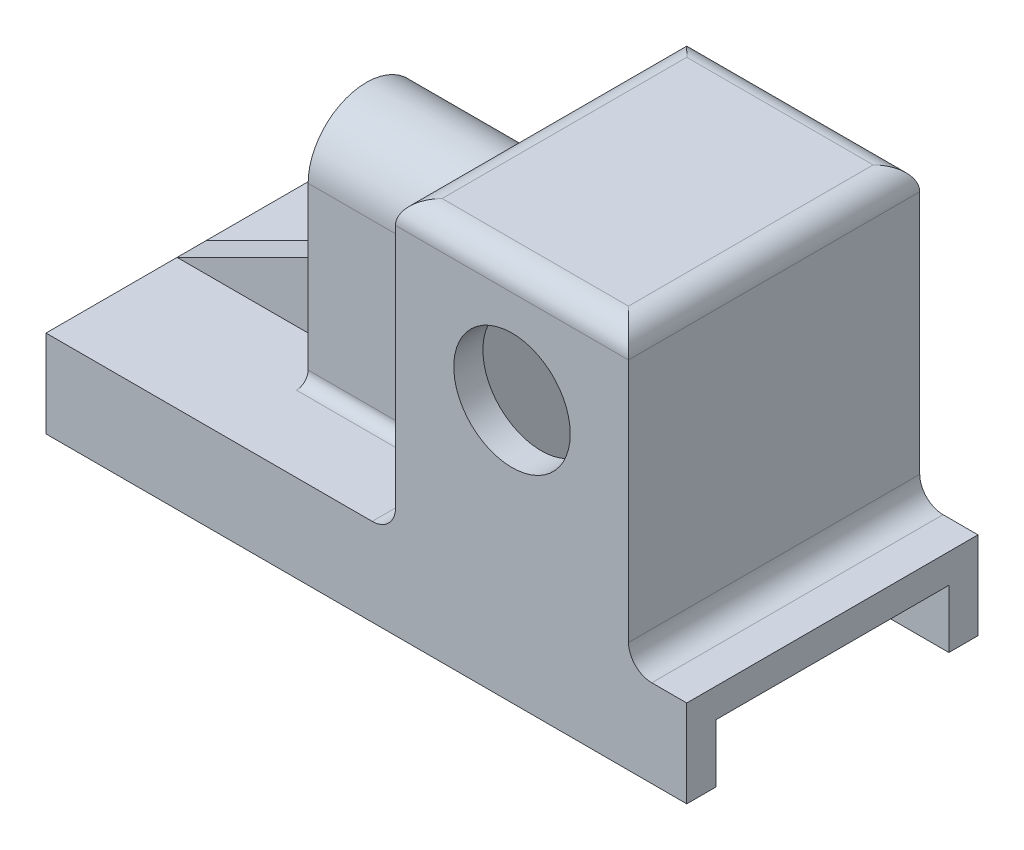
from build123d import *

# Parameters (mm, degrees)
SKETCH1_W                         = 110
SKETCH1_H                         = 15
BOSS_EXTRUDE1_DEPTH               = 25
SKETCH2_W                         = 40
SKETCH2_H                         = 10
CUT_EXTRUDE1_DEPTH                = 114.798066767
SKETCH3_W                         = 40
SKETCH3_H                         = 50
SKETCH3_R                         = 10
BOSS_EXTRUDE2_DEPTH               = 50
FILLET1_R                         = 4
CUT_EXTRUDE2_DEPTH                = 20
FILLET2_R                         = 2
BOSS_EXTRUDE3_DEPTH               = 30
RIB2_REACH                        = 90.741
SKETCH7_WALL_W                    = 213.023413156
SKETCH7_WALL_H                    = 5
FILLET3_R                         = 2
FILLET4_R                         = 4
TAP_DRILL_FOR_M12X1_75_TAP1_D     = 10.2
TAP_DRILL_FOR_M12X1_75_TAP1_DEPTH = 22
TAP_DRILL_FOR_M12X1_75_TAP1_TIP   = 3.064389157


with BuildPart() as part:
    # Sketch1 → Boss-Extrude1 (new, symmetric)
    with BuildSketch(Plane.XY):
        with Locations((0, 7.5)):
            Rectangle(SKETCH1_W, SKETCH1_H)
    extrude(amount=BOSS_EXTRUDE1_DEPTH, both=True)

    # Sketch2 → Cut-Extrude1 (cut, through all)
    with BuildSketch(Plane(origin=(55, 0, 0), x_dir=(0, 0, -1), z_dir=(1, 0, 0))):
        with Locations((0, 5)):
            Rectangle(SKETCH2_W, SKETCH2_H)
    extrude(amount=-CUT_EXTRUDE1_DEPTH, mode=Mode.SUBTRACT)

    # Sketch3 → Boss-Extrude2 (add)
    with BuildSketch(Plane.XY.offset(25)):
        with Locations((25, 40)):
            Rectangle(SKETCH3_W, SKETCH3_H)
        with Locations((25, 45)):
            Circle(SKETCH3_R, mode=Mode.SUBTRACT)
    extrude(amount=-BOSS_EXTRUDE2_DEPTH)

    # Fillet1
    fillet1_edges = [part.edges().sort_by_distance(p)[0] for p in [
        (25, 65, -25),
        (5, 65, 0),
        (45, 65, 0),
        (45, 15, 0),
        (25, 65, 25),
    ]]
    fillet(fillet1_edges, radius=FILLET1_R)

    # Sketch5 → Cut-Extrude2 (cut, symmetric)
    with BuildSketch(Plane.XY):
        with BuildLine():
            Line((10, 10), (40, 10))
            Line((40, 10), (40, 58))
            ThreePointArc((40, 58), (39.414213562, 59.414213562), (38, 60))
            Line((38, 60), (12, 60))
            ThreePointArc((12, 60), (10.585786438, 59.414213562), (10, 58))
            Line((10, 58), (10, 10))
        make_face()
    extrude(amount=CUT_EXTRUDE2_DEPTH, both=True, mode=Mode.SUBTRACT)

    # Fillet2
    # the kernel refuses this fillet: 2 mm, written as the material it adds along each edge
    with BuildSketch(Plane(origin=(43, 60, 20), x_dir=(0, -1, 0), z_dir=(-1, 0, 0))) as fillet2_piece_1:
        with BuildLine():
            CenterArc((FILLET2_R, -FILLET2_R), FILLET2_R, 90, 90)
            Line((0, -FILLET2_R), (0, 0))
            Line((0, 0), (FILLET2_R, 0))
        make_face()
    extrude(amount=36)
    with BuildSketch(Plane(origin=(43, 60, -20), x_dir=(0, -1, 0), z_dir=(-1, 0, 0))) as fillet2_piece_2:
        with BuildLine():
            CenterArc((FILLET2_R, FILLET2_R), FILLET2_R, 180, 90)
            Line((0, FILLET2_R), (0, 0))
            Line((0, 0), (FILLET2_R, 0))
        make_face()
    extrude(amount=36)

    # Sketch6 → Boss-Extrude3 (add)
    with BuildSketch(Plane.ZY.offset(-5)):
        with BuildLine():
            Line((-10, 15), (10, 15))
            Line((10, 15), (10, 44.76267782))
            ThreePointArc((10, 44.76267782), (0, 54.76267782), (-10, 44.76267782))
            Line((-10, 44.76267782), (-10, 15))
        make_face()
    extrude(amount=BOSS_EXTRUDE3_DEPTH)

    # Sketch7 wall → Rib2 (add, up to next)
    with BuildSketch(Plane(origin=(-40, 22.5, 0), x_dir=(-0.894427191, -0.4472135955, 0), z_dir=(0.4472135955, -0.894427191, 0)), mode=Mode.PRIVATE) as rib2_sk1:
        Rectangle(SKETCH7_WALL_W, SKETCH7_WALL_H)
    rib2_tool1 = extrude(rib2_sk1.sketch, amount=RIB2_REACH, mode=Mode.PRIVATE) - part.part
    add(rib2_tool1.solids().sort_by_distance((-40, 22.5, 0))[0])

    # Fillet3
    fillet3_edges = [part.edges().sort_by_distance(p)[0] for p in [
        (5, 29.88133891, -10),
        (-10, 15, -10),
        (5, 29.88133891, 10),
        (-10, 15, 10),
        (5, 54.76267782, 0),
    ]]
    fillet(fillet3_edges, radius=FILLET3_R)

    # Fillet4
    # the kernel refuses this fillet: 4 mm, written as the material it adds along each edge
    with BuildSketch(Plane(origin=(1, 19, -10), x_dir=(0, -1, 0), z_dir=(-1, 0, 0))) as fillet4_piece_1:
        with BuildLine():
            CenterArc((2, -2), 2, 0, 90)
            Line((4, -2), (4, 0))
            Line((4, 0), (2, 0))
        make_face()
    revolve(axis=Axis((1, 19, -10), (0, 0, 1)), revolution_arc=90)
    with BuildSketch(Plane(origin=(1, 19, 10), x_dir=(1, 0, 0), z_dir=(0, 1, 0))) as fillet4_piece_2:
        with BuildLine():
            CenterArc((2, -2), 2, 0, 90)
            Line((4, -2), (4, 0))
            Line((4, 0), (2, 0))
        make_face()
    revolve(axis=Axis((1, 19, 10), (0, 0, -1)), revolution_arc=90)
    with BuildSketch(Plane(origin=(5, 15, 25), x_dir=(-1, 0, 0), z_dir=(0, 0, -1)), Plane(origin=(5, 15, -10), x_dir=(-1, 0, 0), z_dir=(0, 0, -1))) as fillet4_piece_3:
        with BuildLine():
            CenterArc((FILLET4_R, FILLET4_R), FILLET4_R, 180, 90)
            Line((0, FILLET4_R), (0, 0))
            Line((0, 0), (FILLET4_R, 0))
        make_face()
    extrude(amount=15)

    # Tap Drill for M12x1.75 Tap1
    with Locations(Plane(origin=(-25, 44.76267782, 0), x_dir=(0, -1, 0), z_dir=(-1, 0, 0))):
        with Locations((0, 0)):
            Hole(TAP_DRILL_FOR_M12X1_75_TAP1_D / 2, depth=TAP_DRILL_FOR_M12X1_75_TAP1_DEPTH)
            with Locations((0, 0, -(TAP_DRILL_FOR_M12X1_75_TAP1_DEPTH + TAP_DRILL_FOR_M12X1_75_TAP1_TIP / 2))):  # 118° drill point
                Cone(0, TAP_DRILL_FOR_M12X1_75_TAP1_D / 2, TAP_DRILL_FOR_M12X1_75_TAP1_TIP, mode=Mode.SUBTRACT)

    # Chamfer3: read off the stored shape, not the designer's step
    # Chamfer3 outline → Chamfer3 (revolve, cut)
    with BuildSketch(Plane(origin=(0, 44.76267782, 0), x_dir=(0, 1, 0), z_dir=(0, 0, -1))):
        Polygon((6.7, -25), (5.1, -23.4), (5.1, -25), align=None)
    revolve(axis=Axis((0, 44.76267782, 0), (1, 0, 0)), mode=Mode.SUBTRACT)


solid = part.part
